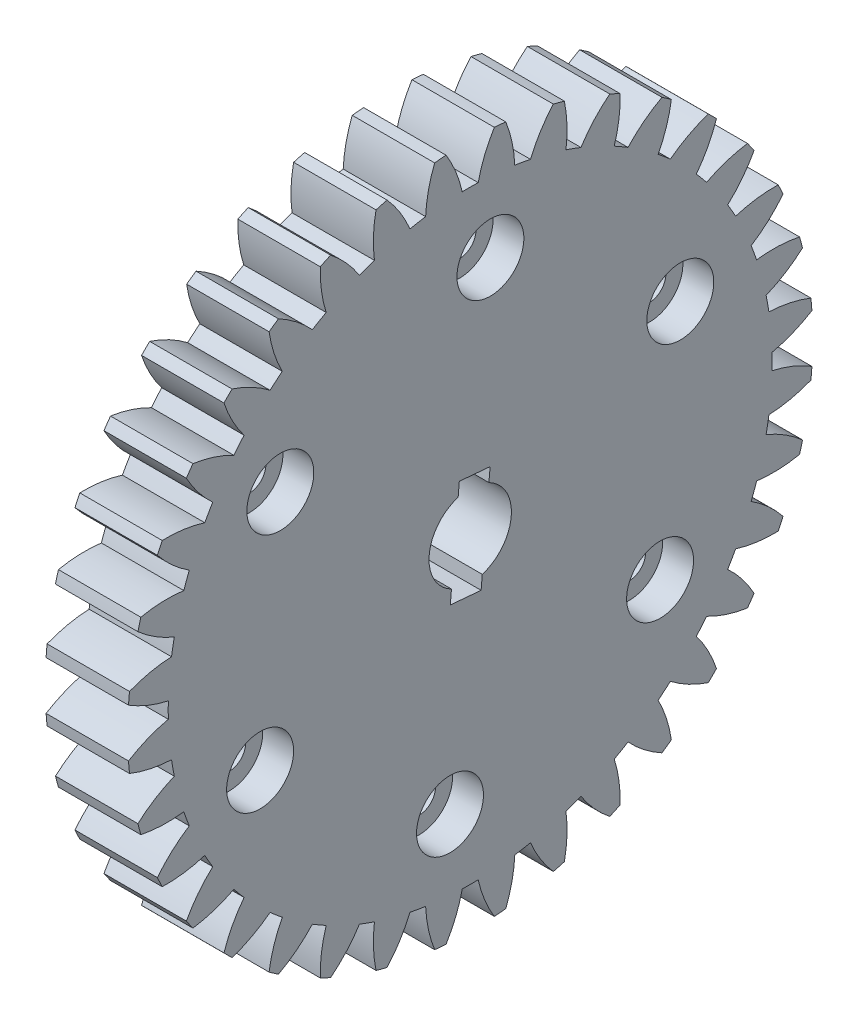
from build123d import *

# Parameters (mm, degrees)
BASPROSKE_W                  = 8
BASPROSKE_H                  = 33.25
TOOTHCUT_DEPTH               = 48.698270409
TEETHCUTS_COUNT              = 36
TEETHCUTS_ANGLE              = 350
BORSKE_R                     = 4
BORE_DEPTH                   = 50.0000508
ESQUISSE2_R                  = 1.6
ENL_V_MAT_EXTRU_2_DEPTH      = 10
ESQUISSE3_R                  = 3.25
ENL_V_MAT_EXTRU_3_DEPTH      = 3
R_P_TITION_CIRCULAIRE1_COUNT = 6
ENL_V_MAT_EXTRU_4_DEPTH      = 10


with BuildPart() as part:
    # BasProSke → Base-Revolve (revolve)
    with BuildSketch(Plane(origin=(0, 0, 0), x_dir=(1, 0, 0), z_dir=(0, 1, 0))):
        with Locations((4, 16.625)):
            Rectangle(BASPROSKE_W, BASPROSKE_H)
    revolve(axis=Axis((-10, 0, 0), (1, 0, 0)))

    # TooCutSke → ToothCut (cut, through all)
    with BuildSketch(Plane(origin=(0, 0, 0), x_dir=(0, 0, -1), z_dir=(1, 0, 0))):
        with BuildLine():
            ThreePointArc((0.773836769, 29.3012834), (0, 29.3115), (-0.773836769, 29.3012834))
            ThreePointArc((-0.773836769, 29.3012834), (-1.403294931, 31.313012095), (-2.359315682, 33.19165369))
            ThreePointArc((-2.359315682, 33.19165369), (0, 33.2754), (2.359315682, 33.19165369))
            ThreePointArc((2.359315682, 33.19165369), (1.403294931, 31.313012095), (0.773836769, 29.3012834))
        make_face()
    toothcut = extrude(amount=TOOTHCUT_DEPTH, mode=Mode.SUBTRACT)

    # TeethCuts: ToothCut ×36 about axis
    teethcuts_axis = Axis((-10, 0, 0), (1, 0, 0))
    for i in range(1, TEETHCUTS_COUNT):
        add(toothcut.rotate(teethcuts_axis, i * TEETHCUTS_ANGLE / (TEETHCUTS_COUNT - 1)), mode=Mode.SUBTRACT)

    # BorSke → Bore (cut, symmetric)
    with BuildSketch(Plane(origin=(0, 0, 0), x_dir=(0, 0, -1), z_dir=(1, 0, 0))):
        Circle(BORSKE_R)
    extrude(amount=BORE_DEPTH, both=True, mode=Mode.SUBTRACT)

    # Esquisse2 → Enlèv. mat.-Extru.2 (cut)
    with BuildSketch(Plane(origin=(8, 0, 0), x_dir=(0, 0, -1), z_dir=(1, 0, 0))):
        with Locations((1.961004212, 22.414380707)):
            Circle(ESQUISSE2_R)
    enl_v_mat_extru_2 = extrude(amount=-ENL_V_MAT_EXTRU_2_DEPTH, mode=Mode.SUBTRACT)

    # Esquisse3 → Enlèv. mat.-Extru.3 (cut)
    with BuildSketch(Plane(origin=(8, 0, 0), x_dir=(0, 0, -1), z_dir=(1, 0, 0))):
        with Locations((1.961004212, 22.414380707)):
            Circle(ESQUISSE3_R)
    enl_v_mat_extru_3 = extrude(amount=-ENL_V_MAT_EXTRU_3_DEPTH, mode=Mode.SUBTRACT)

    # Répétition circulaire1: Enlèv. mat.-Extru.2, Enlèv. mat.-Extru.3 ×6 about axis
    r_p_tition_circulaire1_axis = Axis((50.0000508, 0, 0), (-1, 0, 0))
    add([enl_v_mat_extru_2.rotate(r_p_tition_circulaire1_axis, i * 360 / R_P_TITION_CIRCULAIRE1_COUNT) for i in range(1, R_P_TITION_CIRCULAIRE1_COUNT)], mode=Mode.SUBTRACT)
    add([enl_v_mat_extru_3.rotate(r_p_tition_circulaire1_axis, i * 360 / R_P_TITION_CIRCULAIRE1_COUNT) for i in range(1, R_P_TITION_CIRCULAIRE1_COUNT)], mode=Mode.SUBTRACT)

    # Esquisse4 → Enlèv. mat.-Extru.4 (cut)
    with BuildSketch(Plane(origin=(8, 0, 0), x_dir=(0, 0, -1), z_dir=(1, 0, 0))):
        Polygon((1.058513333, -5.111707105), (-1.930070761, -4.850239876), (-1.058513333, 5.111707105), (1.930070761, 4.850239876), align=None)
    extrude(amount=-ENL_V_MAT_EXTRU_4_DEPTH, mode=Mode.SUBTRACT)


solid = part.part
